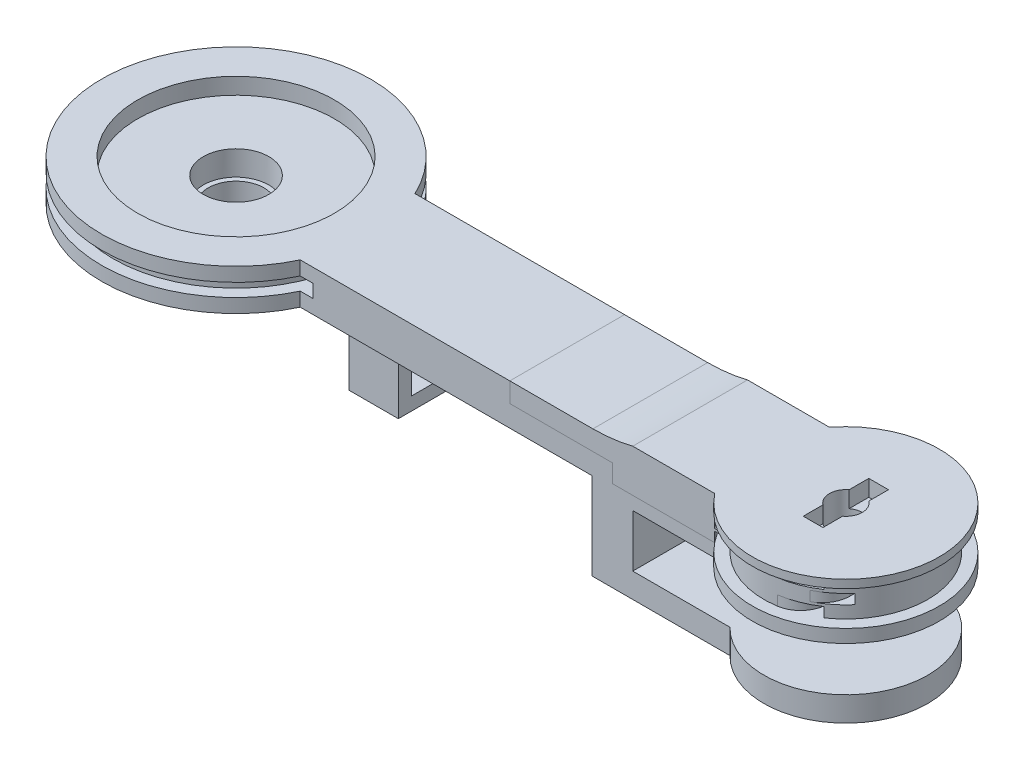
from build123d import *
from build123d.topology import SkipClean

# Parameters (mm, degrees)
SKETCH1_R                               = 5
ELBOWPULLEYMIDSECTION_DEPTH             = 2.1
SKETCH5_W                               = 0.6
SKETCH5_H                               = 0.6
CABLESLOTS_DEPTH                        = 45.290631063
RADIUSAXLEHOLE_DEPTH                    = 44.387901539
RADIUSAXLELOCK_DEPTH                    = 1
CABLESLOT1ENTRANCES_START               = -1.1
CABLESLOT1ENTRANCES_DEPTH               = 0.6
CABLESLOT2ENTRANCES_START               = -1.85
CABLESLOT2ENTRANCES_DEPTH               = 0.6
CABLESLOT3ENTRANCES_START               = -2.6
CABLESLOT3ENTRANCES_DEPTH               = 0.6
BONE_START                              = 1.05
BONE_DEPTH                              = 1.25
SKETCH15_W                              = 2.1
SKETCH15_H                              = 0.7
CABLECLEARANCECUT_DEPTH                 = 2.1
SKETCH37_R                              = 5.7
SKETCH37_R_2                            = 1
THICKNESSPADDING_FOR_PA12PRINTING_DEPTH = 0.3
THICKNESSPADDING_DEPTH                  = 0.3
THICKNESSPADDING2_START                 = -3.1
THICKNESSPADDING2_DEPTH                 = 0.6
SKETCH17_W                              = 2.5
SKETCH17_H                              = 7
RADIUSHOLDERCOLUMN_DEPTH                = 3.8
SKETCH32_W                              = 1.5
SKETCH32_H                              = 1.5
TUBECLIPENTRANCE_DEPTH                  = 2
SKETCH33_W                              = 1.5
SKETCH33_H                              = 1.5
TUBECLIPLOCKSLOT_DEPTH                  = 0.6
SKETCH46_W                              = 1.5
SKETCH46_H                              = 0.2
TUBECLIPLOCKCLEARANCE_DEPTH             = 0.5
SKETCH18_R                              = 1
RADIUSHOLDERMOUTH_DEPTH                 = 1.5
FILLET1_R                               = 10
SKETCH34_W                              = 6.6
SKETCH34_H                              = 3.1
SKETCH34_W_2                            = 1.5
SKETCH34_H_2                            = 1.5
TUBEGUIDES_DEPTH                        = 3
CABLESEPARATOR_START                    = 0.6
CABLESEPARATOR_DEPTH                    = 0.15
CABLESEPARATOR2_START                   = 1.35
CABLESEPARATOR2_DEPTH                   = 0.15
SKETCH40_R                              = 7.5
SHOULDERPULLEYMIDSECTION_DEPTH          = 0.4
CABLECLEARANCECUT2_DEPTH                = 0.8
SKETCH43_R                              = 2
BALLBEARINGSLOT_DEPTH                   = 2.5
SKETCH43_3_R                            = 6
SKETCH43_3_R_2                          = 2
BALLBEARINGCAPSLOT_DEPTH                = 1
SKETCH44_R                              = 2.7
SKETCH44_R_2                            = 1.7
BALLBEARINGSTOPPER_DEPTH                = 1.2
SPLIT1_SURFACE_1_BACK                   = 55.275
SPLIT1_SURFACE_1_DEPTH                  = 110.55
SPLIT1_SURFACE_2_BACK                   = 55.275
SPLIT1_SURFACE_2_DEPTH                  = 110.55


# Read off the part's stored shape, not the designer's step: CableSeparator, CableSeparator2
with BuildPart() as part:
    # Sketch1 → ElbowPulleyMidSection (new body)
    with BuildSketch(Plane(origin=(0, 0, 0), x_dir=(1, 0, 0), z_dir=(0, 1, 0))):
        with Locations(Location((37.2, 0, 0), (0, 0, 270))):
            Circle(SKETCH1_R)
    extrude(amount=ELBOWPULLEYMIDSECTION_DEPTH)

    # Sketch4 → ElbowPulleyCap (revolve)
    with BuildSketch(Plane.XY, mode=Mode.PRIVATE) as elbowpulleycap_sk:
        Polygon((37.2, 2.1), (42.2, 2.1), (42.9, 2.3), (42.9, 2.6), (37.2, 2.6), align=None)
        Polygon((42.2, 2.1), (42.9, 2.1), (42.9, 2.3), align=None)
    elbowpulleycap = revolve(elbowpulleycap_sk.sketch.rotate(Axis((37.2, 2.1, 0), (0, -1, 0)), 90), axis=Axis((37.2, 2.1, 0), (0, -1, 0)))

    # ElbowPulleyCap2: ElbowPulleyCap across plane
    add(elbowpulleycap.mirror(Plane.ZX.offset(1.05)))

    # Sketch5 → CableSlots (cut, through all)
    with BuildSketch(Plane.XY.offset(5)):
        with Locations((40.7, 1.05)):
            Rectangle(SKETCH5_W, SKETCH5_H)
        with Locations((39.7, 1.8)):
            Rectangle(SKETCH5_W, SKETCH5_H)
        with Locations((39.7, 0.3)):
            Rectangle(SKETCH5_W, SKETCH5_H)
    extrude(amount=-CABLESLOTS_DEPTH, mode=Mode.SUBTRACT)

    # Sketch6 → RadiusAxleHole (cut, through all)
    with SkipClean():  # the faces are left unmerged after this step: merging them gives an invalid solid
        with BuildSketch(Plane(origin=(0, 2.6, 0), x_dir=(1, 0, 0), z_dir=(0, 1, 0))):
            with BuildLine():
                Line((37.8, -0.8), (37.8, 0))
                Line((37.8, 0), (37.8, 0.8))
                ThreePointArc((37.8, 0.8), (37.2, 1), (36.6, 0.8))
                Line((36.6, 0.8), (36.6, 0))
                Line((36.6, 0), (36.6, -0.8))
                ThreePointArc((36.6, -0.8), (37.2, -1), (37.8, -0.8))
            make_face()
            with BuildLine():
                Line((37.8, 0.8), (37.8, 0))
                Line((37.8, 0), (37.8, -0.8))
                ThreePointArc((37.8, -0.8), (38.094427191, -0.447213595), (38.2, 0))
                ThreePointArc((38.2, 0), (38.094427191, 0.447213595), (37.8, 0.8))
            make_face()
            with BuildLine():
                Line((36.6, 0), (36.6, 0.8))
                ThreePointArc((36.6, 0.8), (36.2, 0), (36.6, -0.8))
                Line((36.6, -0.8), (36.6, 0))
            make_face()
        extrude(amount=-RADIUSAXLEHOLE_DEPTH, mode=Mode.SUBTRACT)
    add(part.part.scale(1), mode=Mode.REPLACE)  # the faces are merged on a copy

    # Sketch6<3> → RadiusAxleLock (cut)
    with BuildSketch(Plane(origin=(0, 2.6, 0), x_dir=(1, 0, 0), z_dir=(0, 1, 0))):
        with BuildLine():
            ThreePointArc((36.6, 0.8), (37.2, 1), (37.8, 0.8))
            Line((37.8, 0.8), (37.8, 2))
            Line((37.8, 2), (36.6, 2))
            Line((36.6, 2), (36.6, 0.8))
        make_face()
        with BuildLine():
            Line((37.8, -2), (37.8, -0.8))
            ThreePointArc((37.8, -0.8), (37.2, -1), (36.6, -0.8))
            Line((36.6, -0.8), (36.6, -2))
            Line((36.6, -2), (37.8, -2))
        make_face()
    extrude(amount=-RADIUSAXLELOCK_DEPTH, mode=Mode.SUBTRACT)

    # Sketch8 → CableSlot1Entrances (cut)
    with BuildSketch(Plane(origin=(0, 2.6, 0), x_dir=(1, 0, 0), z_dir=(0, 1, 0)).offset(CABLESLOT1ENTRANCES_START)):
        with BuildLine():
            Line((39.4, -4.489988864), (39.4, -3.261901286))
            ThreePointArc((39.4, -3.261901286), (38.989937748, -4.369177496), (37.957575758, -4.942274676))
            ThreePointArc((37.957575758, -4.942274676), (38.695979346, -4.770958582), (39.4, -4.489988864))
        make_face()
        with BuildLine():
            Line((39.4, 3.261901286), (39.4, 4.489988864))
            ThreePointArc((39.4, 4.489988864), (38.695979346, 4.770958582), (37.957575758, 4.942274676))
            ThreePointArc((37.957575758, 4.942274676), (38.989937748, 4.369177496), (39.4, 3.261901286))
        make_face()
    extrude(amount=CABLESLOT1ENTRANCES_DEPTH, mode=Mode.SUBTRACT)

    # Sketch8<3> → CableSlot2Entrances (cut)
    with BuildSketch(Plane(origin=(0, 2.6, 0), x_dir=(1, 0, 0), z_dir=(0, 1, 0)).offset(CABLESLOT2ENTRANCES_START)):
        with BuildLine():
            ThreePointArc((40, -4.142463035), (40.203762368, -3.997175458), (40.4, -3.841874542))
            Line((40.4, -3.841874542), (40.4, -2.939387691))
            ThreePointArc((40.4, -2.939387691), (40.149764871, -3.827183737), (39.472727273, -4.453617714))
            ThreePointArc((39.472727273, -4.453617714), (39.741130615, -4.306118344), (40, -4.142463035))
        make_face()
        with BuildLine():
            Line((40.4, 2.939387691), (40.4, 3.841874542))
            ThreePointArc((40.4, 3.841874542), (40.203762368, 3.997175458), (40, 4.142463035))
            ThreePointArc((40, 4.142463035), (39.741130615, 4.306118344), (39.472727273, 4.453617714))
            ThreePointArc((39.472727273, 4.453617714), (40.149764871, 3.827183737), (40.4, 2.939387691))
        make_face()
    extrude(amount=CABLESLOT2ENTRANCES_DEPTH, mode=Mode.SUBTRACT)

    # Sketch8<4> → CableSlot3Entrances (cut)
    with BuildSketch(Plane(origin=(0, 2.6, 0), x_dir=(1, 0, 0), z_dir=(0, 1, 0)).offset(CABLESLOT3ENTRANCES_START)):
        with BuildLine():
            Line((39.4, -4.489988864), (39.4, -3.261901286))
            ThreePointArc((39.4, -3.261901286), (38.989937748, -4.369177496), (37.957575758, -4.942274676))
            ThreePointArc((37.957575758, -4.942274676), (38.695979346, -4.770958582), (39.4, -4.489988864))
        make_face()
        with BuildLine():
            Line((39.4, 3.261901286), (39.4, 4.489988864))
            ThreePointArc((39.4, 4.489988864), (38.695979346, 4.770958582), (37.957575758, 4.942274676))
            ThreePointArc((37.957575758, 4.942274676), (38.989937748, 4.369177496), (39.4, 3.261901286))
        make_face()
    extrude(amount=CABLESLOT3ENTRANCES_DEPTH, mode=Mode.SUBTRACT)

    # Sketch1<4> → Bone (add, symmetric)
    with BuildSketch(Plane(origin=(0, 0, 0), x_dir=(1, 0, 0), z_dir=(0, 1, 0)).offset(BONE_START)):
        with BuildLine():
            Line((33.629285786, 3.5), (7.415524257, 3.5))
            ThreePointArc((7.415524257, 3.5), (8.2, 0), (7.415524257, -3.5))
            Line((7.415524257, -3.5), (33.629285786, -3.5))
            ThreePointArc((33.629285786, -3.5), (32.2, 0), (33.629285786, 3.5))
        make_face()
    extrude(amount=BONE_DEPTH, both=True)

    # Sketch15 → CableWay (revolve, cut)
    with BuildSketch(Plane(origin=(18.228, 0, 18.596279628), x_dir=(0, -1, 0), z_dir=(-0.6999999999988543, 0, -0.714142842855408)), mode=Mode.PRIVATE) as cableway_sk:
        with Locations((-1.05, -21.216113754)):
            Rectangle(SKETCH15_W, SKETCH15_H)
    revolve(cableway_sk.sketch.rotate(Axis((37.2, -0.5, 0), (0, 1, 0)), 45.572996), axis=Axis((37.2, -0.5, 0), (0, 1, 0)), mode=Mode.SUBTRACT)

    # Sketch26 → CableClearanceCut (cut)
    with BuildSketch(Plane(origin=(0, 0, 0), x_dir=(1, 0, 0), z_dir=(0, 1, 0))):
        with BuildLine():
            ThreePointArc((32.559831346, -3.310413095), (31.501226079, 0.118219293), (32.701111248, 3.5))
            Line((32.701111248, 3.5), (27.701111248, 3.5))
            Line((27.701111248, 3.5), (32.559831346, -3.310413095))
        make_face()
    extrude(amount=CABLECLEARANCECUT_DEPTH, mode=Mode.SUBTRACT)

    # Sketch37 → ThicknessPadding_for_PA12printing (add)
    with SkipClean():  # the faces are left unmerged after this step: merging them gives an invalid solid
        with BuildSketch(Plane.XZ.offset(0.5)):
            with Locations(Location((37.2, 0, 0), (0, 0, 90))):
                Circle(SKETCH37_R)
            with Locations(Location((37.2, 0, 0), (0, 0, 53.130102354))):
                Circle(SKETCH37_R_2, mode=Mode.SUBTRACT)
        extrude(amount=THICKNESSPADDING_FOR_PA12PRINTING_DEPTH)

    # Sketch27 → ThicknessPadding (add)
    with SkipClean():  # the faces are left unmerged after this step: merging them gives an invalid solid
        with BuildSketch(Plane(origin=(0, 2.3, 0), x_dir=(1, 0, 0), z_dir=(0, 1, 0))):
            with BuildLine():
                Line((33.629285786, 3.5), (27.701111248, 3.5))
                Line((27.701111248, 3.5), (27.701111248, -3.5))
                Line((27.701111248, -3.5), (33.629285786, -3.5))
                ThreePointArc((33.629285786, -3.5), (32.2, 0), (33.629285786, 3.5))
            make_face()
        extrude(amount=THICKNESSPADDING_DEPTH)

    # Sketch27<2> → ThicknessPadding2 (add)
    with SkipClean():  # the faces are left unmerged after this step: merging them gives an invalid solid
        with BuildSketch(Plane(origin=(0, 2.3, 0), x_dir=(1, 0, 0), z_dir=(0, 1, 0)).offset(THICKNESSPADDING2_START)):
            with BuildLine():
                Line((33.629285786, 3.5), (27.701111248, 3.5))
                Line((27.701111248, 3.5), (27.701111248, -3.5))
                Line((27.701111248, -3.5), (33.629285786, -3.5))
                ThreePointArc((33.629285786, -3.5), (32.2, 0), (33.629285786, 3.5))
            make_face()
        extrude(amount=THICKNESSPADDING2_DEPTH)

    # Sketch17 → RadiusHolderColumn (add)
    with SkipClean():  # the faces are left unmerged after this step: merging them gives an invalid solid
        with BuildSketch(Plane.XZ.offset(0.2)):
            with Locations((26.45, 0)):
                Rectangle(SKETCH17_W, SKETCH17_H)
        extrude(amount=RADIUSHOLDERCOLUMN_DEPTH)

    # Sketch32 → TubeClipEntrance (cut)
    with SkipClean():  # the faces are left unmerged after this step: merging them gives an invalid solid
        with BuildSketch(Plane.ZY.offset(-25.2)):
            with Locations((-1.75, -2.1)):
                Rectangle(SKETCH32_W, SKETCH32_H)
        tubeclipentrance = extrude(amount=-TUBECLIPENTRANCE_DEPTH, mode=Mode.SUBTRACT)

    # Sketch33 → TubeClipLockSlot (cut)
    with SkipClean():  # the faces are left unmerged after this step: merging them gives an invalid solid
        with BuildSketch(Plane(origin=(50.45, -1.35, 0), x_dir=(-1, 0, 0), z_dir=(0, 1, 0))):
            with Locations((24, -1.75)):
                Rectangle(SKETCH33_W, SKETCH33_H)
        tubecliplockslot = extrude(amount=TUBECLIPLOCKSLOT_DEPTH, mode=Mode.SUBTRACT)

    # Sketch46 → TubeClipLockClearance (cut)
    with SkipClean():  # the faces are left unmerged after this step: merging them gives an invalid solid
        with BuildSketch(Plane.ZY.offset(-25.2)):
            with Locations((-1.75, -1.25)):
                Rectangle(SKETCH46_W, SKETCH46_H)
        tubecliplockclearance = extrude(amount=-TUBECLIPLOCKCLEARANCE_DEPTH, mode=Mode.SUBTRACT)

    # TubeClipSlot2: TubeClipEntrance, TubeClipLockSlot, TubeClipLockClearance across plane
    with SkipClean():  # the faces are left unmerged after this step: merging them gives an invalid solid
        add(tubeclipentrance.mirror(Plane.XY), mode=Mode.SUBTRACT)
        add(tubecliplockslot.mirror(Plane.XY), mode=Mode.SUBTRACT)
        add(tubecliplockclearance.mirror(Plane.XY), mode=Mode.SUBTRACT)

    # Sketch18 → RadiusHolderMouth (add)
    with SkipClean():  # the faces are left unmerged after this step: merging them gives an invalid solid
        with BuildSketch(Plane.XZ.offset(4)):
            with BuildLine():
                Line((33.629285786, 3.5), (25.2, 3.5))
                Line((25.2, 3.5), (25.2, -3.5))
                Line((25.2, -3.5), (33.629285786, -3.5))
                ThreePointArc((33.629285786, -3.5), (42.2, 0), (33.629285786, 3.5))
            make_face()
            with Locations(Location((37.2, 0, 0), (0, 0, 53.130102354))):
                Circle(SKETCH18_R, mode=Mode.SUBTRACT)
        extrude(amount=RADIUSHOLDERMOUTH_DEPTH)

    # Fillet1
    # the kernel refuses this fillet: 10 mm, written as the material it adds along each edge
    with BuildSketch(Plane(origin=(27.701111248, 2.3, -3.5), x_dir=(-1, 0, 0), z_dir=(0, 0, 1))) as fillet1_piece_1:
        with BuildLine():
            CenterArc((2.431049156, -10), FILLET1_R, 90, 14.069867748)
            Line((0, -0.3), (-0.048620983, -0.106))
            ThreePointArc((-0.048620983, -0.106), (-0.2, -0.15), (-0.2, 0))
            Line((-0.2, 0), (0, 0.2))
            Line((0, 0.2), (2.431049156, 0.2))
            Line((2.431049156, 0.2), (2.431049156, 0))
        make_face()
    extrude(amount=7)

    # Sketch34 → TubeGuides (add)
    with BuildSketch(Plane.ZY.offset(-10.2)):
        with Locations((0, -1.75)):
            Rectangle(SKETCH34_W, SKETCH34_H)
        with Locations((-1.75, -1.75)):
            Rectangle(SKETCH34_W_2, SKETCH34_H_2, mode=Mode.SUBTRACT)
        with Locations((1.75, -1.75)):
            Rectangle(SKETCH34_W_2, SKETCH34_H_2, mode=Mode.SUBTRACT)
    extrude(amount=-TUBEGUIDES_DEPTH)

    # CableSeparator outline → CableSeparator (add)
    with BuildSketch(Plane(origin=(0, 0, 0), x_dir=(1, 0, 0), z_dir=(0, 1, 0)).offset(CABLESEPARATOR_START)):
        with BuildLine():
            Line((27.701111248, 3.5), (32.559831346, -3.310413095))
            ThreePointArc((32.559831346, -3.310413095), (32.629488173, -3.40593917), (32.701111248, -3.5))
            Line((32.701111248, -3.5), (33.629285786, -3.5))
            ThreePointArc((33.629285786, -3.5), (32.2, 0), (33.629285786, 3.5))
            Line((33.629285786, 3.5), (27.701111248, 3.5))
        make_face()
    extrude(amount=CABLESEPARATOR_DEPTH)

    # CableSeparator2 outline → CableSeparator2 (add)
    with BuildSketch(Plane(origin=(0, 0, 0), x_dir=(1, 0, 0), z_dir=(0, 1, 0)).offset(CABLESEPARATOR2_START)):
        with BuildLine():
            Line((27.701111248, 3.5), (32.559831346, -3.310413095))
            ThreePointArc((32.559831346, -3.310413095), (32.629488173, -3.40593917), (32.701111248, -3.5))
            Line((32.701111248, -3.5), (33.629285786, -3.5))
            ThreePointArc((33.629285786, -3.5), (32.2, 0), (33.629285786, 3.5))
            Line((33.629285786, 3.5), (27.701111248, 3.5))
        make_face()
    extrude(amount=CABLESEPARATOR2_DEPTH)



with BuildPart() as body_2:
    # Sketch40 → ShoulderPulleyMidSection (new, symmetric)
    with BuildSketch(Plane(origin=(0, 1.05, 0), x_dir=(1, 0, 0), z_dir=(0, 1, 0))):
        with Locations(Location((0, 0, 0), (0, 0, 270))):
            Circle(SKETCH40_R)
    extrude(amount=SHOULDERPULLEYMIDSECTION_DEPTH, both=True)


with BuildPart() as part_1:
    add(part.part)

    add(body_2.part)  # ShoulderPulleyCap merges body 2
    # Sketch41 → ShoulderPulleyCap (revolve)
    with BuildSketch(Plane.XY):
        Polygon((0, 1.45), (7.5, 1.45), (8.2, 1.45), (8.2, 2.3), (0, 2.3), align=None)
    shoulderpulleycap = revolve(axis=Axis((0, 1.45, 0), (0, -1, 0)))

    # ShoulderPulleyCap2: ShoulderPulleyCap across plane
    add(shoulderpulleycap.mirror(Plane.ZX.offset(1.05)))

    # Sketch42 → CableClearanceCut2 (cut)
    with BuildSketch(Plane(origin=(0, 0.65, 0), x_dir=(1, 0, 0), z_dir=(0, 1, 0))):
        with BuildLine():
            Line((8.2, -3.5), (8.2, -1e-09))
            ThreePointArc((8.2, -1e-09), (8.001477954, -1.793418676), (7.415524257, -3.5))
            Line((7.415524257, -3.5), (8.2, -3.5))
        make_face()
        with BuildLine():
            Line((8.2, -1e-09), (8.2, 3.5))
            Line((8.2, 3.5), (7.415524257, 3.5))
            ThreePointArc((7.415524257, 3.5), (8.001477954, 1.793418676), (8.2, -1e-09))
        make_face()
    extrude(amount=CABLECLEARANCECUT2_DEPTH, mode=Mode.SUBTRACT)

    # Sketch43 → BallBearingSlot (cut)
    with BuildSketch(Plane(origin=(0, 2.3, 0), x_dir=(1, 0, 0), z_dir=(0, 1, 0))):
        with Locations(Location((0, 0, 0), (0, 0, 270))):
            Circle(SKETCH43_R)
    extrude(amount=-BALLBEARINGSLOT_DEPTH, mode=Mode.SUBTRACT)

    # Sketch43<3> → BallBearingCapSlot (cut)
    # profile 1 of 2: a face of its own
    with BuildSketch(Plane(origin=(0, 2.3, 0), x_dir=(1, 0, 0), z_dir=(0, 1, 0))):
        with Locations(Location((0, 0, 0), (0, 0, 270))):
            Circle(SKETCH43_3_R)
        with Locations(Location((0, 0, 0), (0, 0, 270))):
            Circle(SKETCH43_3_R_2, mode=Mode.SUBTRACT)
    # profile 2 of 2: a face of its own
    with BuildSketch(Plane(origin=(0, 2.3, 0), x_dir=(1, 0, 0), z_dir=(0, 1, 0))):
        with Locations(Location((0, 0, 0), (0, 0, 270))):
            Circle(SKETCH43_3_R_2)
    extrude(amount=-BALLBEARINGCAPSLOT_DEPTH, mode=Mode.SUBTRACT)

    # Sketch44 → BallBearingStopper (add)
    with BuildSketch(Plane.XZ.offset(0.2)):
        with Locations(Location((0, 0, 0), (0, 0, 90))):
            Circle(SKETCH44_R)
        with Locations(Location((0, 0, 0), (0, 0, 270))):
            Circle(SKETCH44_R_2, mode=Mode.SUBTRACT)
    extrude(amount=BALLBEARINGSTOPPER_DEPTH)


with BuildPart() as body_2_2:
    # Split1: the piece behind the surface
    add(part_1.part)
    # Split1 surface: a surface, the sketch's curves swept straight by 110.55 mm
    with BuildLine(Plane(origin=(0, 0, -3.5), x_dir=(-1, 0, 0), z_dir=(0, 0, -1)).offset(-SPLIT1_SURFACE_1_BACK), mode=Mode.PRIVATE) as split1_surface_1_path:
        Line((-20.2, 2.3), (-20.2, 1.1))
        Line((-20.2, 1.1), (-26.451111248, 1.1))
        Line((-26.451111248, 1.1), (-26.451111248, 0))
        Line((-26.451111248, 0), (-27.701111248, 0))
        Line((-27.701111248, 0), (-32.701111248, 0))
        Line((-32.701111248, 0), (-42.9, 0))
    split1_surface_1 = Shell.extrude(split1_surface_1_path.wire(), (0 * SPLIT1_SURFACE_1_DEPTH, 0 * SPLIT1_SURFACE_1_DEPTH, -1 * SPLIT1_SURFACE_1_DEPTH))
    split(bisect_by=split1_surface_1, keep=Keep.BOTTOM)


with BuildPart() as part_2:
    add(part_1.part)

    # Split1: split by a surface, the side it looks to stays
    # Split1 surface: a surface, the sketch's curves swept straight by 110.55 mm
    with BuildLine(Plane(origin=(0, 0, -3.5), x_dir=(-1, 0, 0), z_dir=(0, 0, -1)).offset(-SPLIT1_SURFACE_2_BACK), mode=Mode.PRIVATE) as split1_surface_2_path:
        Line((-20.2, 2.3), (-20.2, 1.1))
        Line((-20.2, 1.1), (-26.451111248, 1.1))
        Line((-26.451111248, 1.1), (-26.451111248, 0))
        Line((-26.451111248, 0), (-27.701111248, 0))
        Line((-27.701111248, 0), (-32.701111248, 0))
        Line((-32.701111248, 0), (-42.9, 0))
    split1_surface_2 = Shell.extrude(split1_surface_2_path.wire(), (0 * SPLIT1_SURFACE_2_DEPTH, 0 * SPLIT1_SURFACE_2_DEPTH, -1 * SPLIT1_SURFACE_2_DEPTH))
    split(bisect_by=split1_surface_2, keep=Keep.TOP)


solid = Compound([body_2_2.part, part_2.part])
